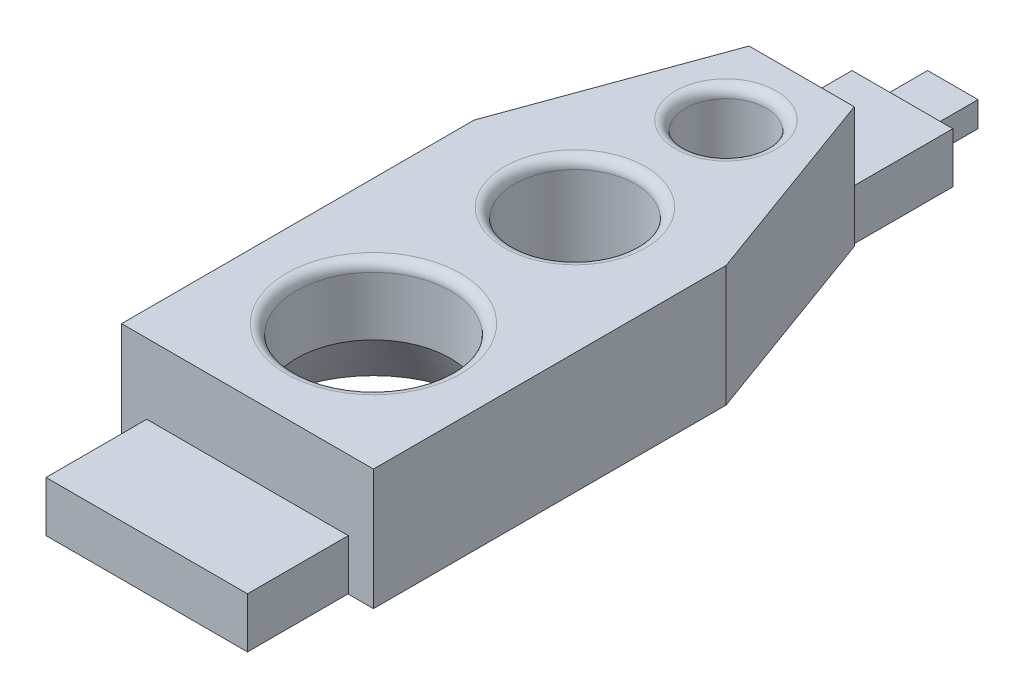
from build123d import *

# Parameters (mm, degrees)
SKETCH1_W           = 2.5
SKETCH1_H           = 6.5
BOSS_EXTRUDE1_DEPTH = 1.2
SKETCH2_R           = 0.6
SKETCH2_R_2         = 0.765
SKETCH2_R_3         = 0.4
CUT_EXTRUDE1_DEPTH  = 1.2
CHAMFER1_SIZE       = 3
CHAMFER1_SIZE2      = 1.091910703
CHAMFER2_SIZE       = 3
CHAMFER2_SIZE2      = 1.091910703
SKETCH3_W           = 2.5
SKETCH3_H           = 1.2
CUT_EXTRUDE2_DEPTH  = 1
CHAMFER3_SIZE       = 0.3
CHAMFER3_SIZE2      = 0.519615242
FILLET1_R           = 0.1
SKETCH4_W           = 1
SKETCH4_H           = 0.5
BOSS_EXTRUDE2_DEPTH = 1
SKETCH5_W           = 2
SKETCH5_H           = 0.5
BOSS_EXTRUDE3_DEPTH = 1
SKETCH6_W           = 0.5
SKETCH6_H           = 0.25
BOSS_EXTRUDE4_DEPTH = 0.5
SKETCH8_W           = 1
SKETCH8_H           = 0.25
BOSS_EXTRUDE6_DEPTH = 0.5
SKETCH9_W           = 2.896936236
SKETCH9_H           = 1.571826666
CUT_EXTRUDE3_DEPTH  = 129.011727979


# Read off the part's stored shape, not the designer's step: Mirror2, Mirror4, Mirror6, Mirror7
with BuildPart() as part:
    # Sketch1 → Boss-Extrude1 (new body)
    with BuildSketch(Plane(origin=(0, 0, 0), x_dir=(1, 0, 0), z_dir=(0, 1, 0))):
        Rectangle(SKETCH1_W, SKETCH1_H)
    extrude(amount=BOSS_EXTRUDE1_DEPTH)

    # Sketch2 → Cut-Extrude1 (cut)
    with BuildSketch(Plane(origin=(0, 1.2, 0), x_dir=(1, 0, 0), z_dir=(0, 1, 0))):
        with Locations(Location((0, 0, 0), (0, 0, 270))):
            Circle(SKETCH2_R)
        with Locations(Location((0, -2, 0), (0, 0, 270))):
            Circle(SKETCH2_R_2)
        with Locations(Location((-0.001766606, 1.5, 0), (0, 0, 270))):
            Circle(SKETCH2_R_3)
    extrude(amount=-CUT_EXTRUDE1_DEPTH, mode=Mode.SUBTRACT)

    # Chamfer1
    chamfer1_edges = [part.edges().sort_by_distance(p)[0] for p in [
        (1.25, 0.6, -3.25),
    ]]
    chamfer1_side = [part.faces().sort_by_distance(p)[0] for p in [
        (1.25, 0.6, 0),
    ]]
    chamfer(chamfer1_edges, length=CHAMFER1_SIZE, length2=CHAMFER1_SIZE2, reference=chamfer1_side[0])

    # Chamfer2
    chamfer2_edges = [part.edges().sort_by_distance(p)[0] for p in [
        (-1.25, 0.6, -3.25),
    ]]
    chamfer2_side = [part.faces().sort_by_distance(p)[0] for p in [
        (-1.25, 0.6, 0),
    ]]
    chamfer(chamfer2_edges, length=CHAMFER2_SIZE, length2=CHAMFER2_SIZE2, reference=chamfer2_side[0])

    # Sketch3 → Cut-Extrude2 (cut)
    with BuildSketch(Plane(origin=(0, 0, -3.25), x_dir=(-1, 0, 0), z_dir=(0, 0, -1))):
        with Locations((0, 0.6)):
            Rectangle(SKETCH3_W, SKETCH3_H)
    extrude(amount=-CUT_EXTRUDE2_DEPTH, mode=Mode.SUBTRACT)

    # Chamfer3
    chamfer3_edges = [part.edges().sort_by_distance(p)[0] for p in [
        (0, 0, 1.235),
    ]]
    chamfer3_side = [part.faces().sort_by_distance(p)[0] for p in [
        (0.000100657, 0, 0.709259096),
    ]]
    chamfer(chamfer3_edges, length=CHAMFER3_SIZE, length2=CHAMFER3_SIZE2, reference=chamfer3_side[0])

    # Fillet1
    fillet1_edges = [part.edges().sort_by_distance(p)[0] for p in [
        (0, 0, -0.6),
        (0, 1.2, -0.6),
        (0, 1.2, 1.235),
        (-0.001766606, 0, -1.9),
        (-0.001766606, 1.2, -1.9),
    ]]
    fillet(fillet1_edges, radius=FILLET1_R)

    # Sketch4 → Boss-Extrude2 (add)
    with BuildSketch(Plane(origin=(0, 0, -2.25), x_dir=(-1, 0, 0), z_dir=(0, 0, -1))):
        with Locations((0, 0.250555681)):
            Rectangle(SKETCH4_W, SKETCH4_H)
    extrude(amount=BOSS_EXTRUDE2_DEPTH)

    # Sketch5 → Boss-Extrude3 (add)
    with BuildSketch(Plane.XY.offset(3.25)):
        with Locations((0, 0.252908482)):
            Rectangle(SKETCH5_W, SKETCH5_H)
    extrude(amount=BOSS_EXTRUDE3_DEPTH)

    # Sketch6 → Boss-Extrude4 (add)
    with BuildSketch(Plane(origin=(0, 0, -3.25), x_dir=(-1, 0, 0), z_dir=(0, 0, -1))):
        with Locations((0, 0.250555681)):
            Rectangle(SKETCH6_W, SKETCH6_H)
    extrude(amount=BOSS_EXTRUDE4_DEPTH)

    # Sketch8 → Boss-Extrude6 (add)
    with BuildSketch(Plane.XY.offset(4.25)):
        with Locations((0, 0.252908482)):
            Rectangle(SKETCH8_W, SKETCH8_H)
    extrude(amount=BOSS_EXTRUDE6_DEPTH)

    # Mirror2: part across plane


with BuildPart() as part_1:
    add(part.part)
    add(part.part.mirror(Plane(origin=(0, 0, 4.75), x_dir=(1, 0, 0), z_dir=(0, 0, -1))))

    # Mirror4: part across plane


with BuildPart() as part_2:
    add(part_1.part)
    add(part_1.part.mirror(Plane.XY.offset(13.25)))

    # Mirror6: part across plane


with BuildPart() as part_3:
    add(part_2.part)
    add(part_2.part.mirror(Plane.XY.offset(30.25)))

    # Mirror7: part across plane


with BuildPart() as part_4:
    add(part_3.part)
    add(part_3.part.mirror(Plane.XY.offset(64.25)))

    # Sketch9 → Cut-Extrude3 (cut, through all)
    with BuildSketch(Plane.XY.offset(4.25)):
        with Locations((0.013927578, 0.592041384)):
            Rectangle(SKETCH9_W, SKETCH9_H)
    extrude(amount=CUT_EXTRUDE3_DEPTH, mode=Mode.SUBTRACT)


solid = part_4.part
